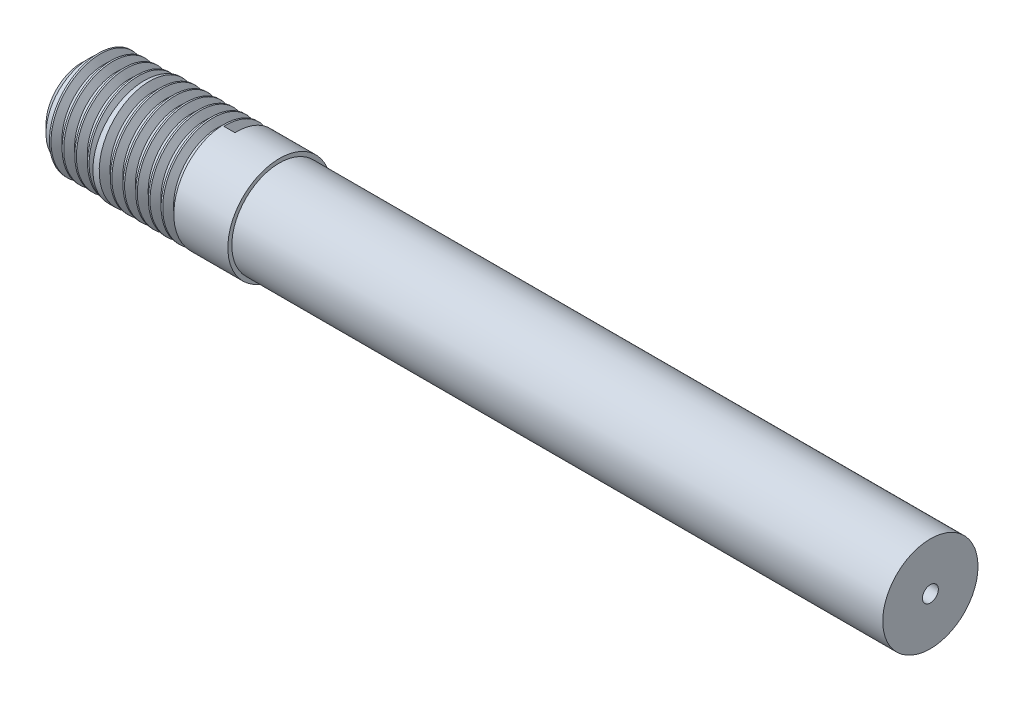
from build123d import *

# Parameters (mm, degrees)
THREAD5_PITCH = 0.8
THREAD6_PITCH = 0.8


# Read off the part's stored shape, not the designer's step: #12-28 Machine Threads Stud1
with BuildPart() as part:
    # Sketch1 → Revolve1 (revolve)
    with BuildSketch(Plane.XY, mode=Mode.PRIVATE) as revolve1_sk:
        Polygon((10, 0.5), (11, 0.5), (11, 3), (-30, 3), (-30, 3.25), (-38.5, 3.25), (-38.5, 3), (-42.5, 3), (-42.5, 2.25), (10, 2.25), align=None)
    revolve(revolve1_sk.sketch.rotate(Axis((13.5, 0, 0), (-1, 0, 0)), 90), axis=Axis((13.5, 0, 0), (-1, 0, 0)))

    # #12-28 Machine Threads Stud1 outline → #12-28 Machine Threads Stud1 (revolve, cut)
    with BuildSketch(Plane.YX):
        Polygon((3, -38.5), (2.7432, -38.5), (2.7432, -41.95898), (2.25, -42.45218), (2.25, -42.5), (3, -42.5), align=None)
    revolve(axis=Axis((0, 0, 0), (1, 0, 0)), mode=Mode.SUBTRACT)

    # Thread5: the profile of Thread Profile6 profile screwed along a right-hand helix of 10 turns, 8 arcs to a turn; built about Z, then put on its axis
    thread5_z = Axis((0, 0, 0), (0, 0, 1))
    thread5_corners = [(2.7429, 0, -0.000173205), (3.1762127, 0, 0.249999999), (3.1762127, 0, 0.349999999), (2.7429, 0, 0.600173203)]
    with BuildLine(mode=Mode.PRIVATE) as thread5_profile:
        Line(thread5_corners[0], thread5_corners[1])
        Line(thread5_corners[1], thread5_corners[2])
        Line(thread5_corners[2], thread5_corners[3])
        Line(thread5_corners[3], thread5_corners[0])
    thread5_cap = Face(thread5_profile.wire())
    thread5_turn_angles = [0, 22.5, 45, 67.5, 90, 112.5, 135, 157.5, 180, 202.5, 225, 247.5, 270, 292.5, 315, 337.5, 360]
    thread5_turn_weights = [1, 0.9238795325112867, 1, 0.9238795325112867, 1, 0.9238795325112867, 1, 0.9238795325112867, 1, 0.9238795325112867, 1, 0.9238795325112867, 1, 0.9238795325112867, 1, 0.9238795325112867, 1]
    thread5_turn_rails = [Edge.make_bspline([Vector(p[0], p[1], 0).rotate(thread5_z, thread5_turn_angles[k]) / thread5_turn_weights[k] + Vector(0, 0, p[2] + THREAD5_PITCH * thread5_turn_angles[k] / 360) for k in range(17)], [0, 0, 0, 1, 1, 2, 2, 3, 3, 4, 4, 5, 5, 6, 6, 7, 7, 8, 8, 8], 2, thread5_turn_weights) for p in thread5_corners]
    thread5_turn_sides = [Face.make_surface_from_curves(thread5_turn_rails[p[0]], thread5_turn_rails[p[1]]) for p in [(0, 1), (1, 2), (2, 3), (3, 0)]]
    thread5 = Plane(origin=(-41.95898, 0, 0), x_dir=(0, 0, -1), z_dir=(1, 0, 0)) * Solid(Shell([*[p.moved(Location((0, 0, THREAD5_PITCH * i))) for i in range(10) for p in thread5_turn_sides], thread5_cap, thread5_cap.rotate(thread5_z, 3600).moved(Location((0, 0, THREAD5_PITCH * 3600 / 360)))]))
    add(thread5)

    # Thread6: the profile of Thread Profile7 profile screwed along a right-hand helix of 6.25 turns, 8 arcs to a turn; built about Z, then put on its axis
    thread6_z = Axis((0, 0, 0), (0, 0, 1))
    thread6_corners = [(3.2503, 0, -0.000173205), (3.2503, 0, 0.700173203), (2.8169873, 0, 0.449999999), (2.8169873, 0, 0.249999999)]
    with BuildLine(mode=Mode.PRIVATE) as thread6_profile:
        Line(thread6_corners[0], thread6_corners[1])
        Line(thread6_corners[1], thread6_corners[2])
        Line(thread6_corners[2], thread6_corners[3])
        Line(thread6_corners[3], thread6_corners[0])
    thread6_cap = Face(thread6_profile.wire())
    thread6_turn_angles = [0, 22.5, 45, 67.5, 90, 112.5, 135, 157.5, 180, 202.5, 225, 247.5, 270, 292.5, 315, 337.5, 360]
    thread6_turn_weights = [1, 0.9238795325112867, 1, 0.9238795325112867, 1, 0.9238795325112867, 1, 0.9238795325112867, 1, 0.9238795325112867, 1, 0.9238795325112867, 1, 0.9238795325112867, 1, 0.9238795325112867, 1]
    thread6_turn_rails = [Edge.make_bspline([Vector(p[0], p[1], 0).rotate(thread6_z, thread6_turn_angles[k]) / thread6_turn_weights[k] + Vector(0, 0, p[2] + THREAD6_PITCH * thread6_turn_angles[k] / 360) for k in range(17)], [0, 0, 0, 1, 1, 2, 2, 3, 3, 4, 4, 5, 5, 6, 6, 7, 7, 8, 8, 8], 2, thread6_turn_weights) for p in thread6_corners]
    thread6_turn_sides = [Face.make_surface_from_curves(thread6_turn_rails[p[0]], thread6_turn_rails[p[1]]) for p in [(0, 1), (1, 2), (2, 3), (3, 0)]]
    thread6_last_angles = [2160, 2182.5, 2205, 2227.5, 2250]
    thread6_last_weights = [1, 0.9238795325112867, 1, 0.9238795325112867, 1]
    thread6_last_rails = [Edge.make_bspline([Vector(p[0], p[1], 0).rotate(thread6_z, thread6_last_angles[k]) / thread6_last_weights[k] + Vector(0, 0, p[2] + THREAD6_PITCH * thread6_last_angles[k] / 360) for k in range(5)], [0, 0, 0, 1, 1, 2, 2, 2], 2, thread6_last_weights) for p in thread6_corners]
    thread6_last_sides = [Face.make_surface_from_curves(thread6_last_rails[p[0]], thread6_last_rails[p[1]]) for p in [(0, 1), (1, 2), (2, 3), (3, 0)]]
    thread6 = Plane(origin=(-38.5, 0, 0), x_dir=(0, 0, -1), z_dir=(1, 0, 0)) * Solid(Shell([*[p.moved(Location((0, 0, THREAD6_PITCH * i))) for i in range(6) for p in thread6_turn_sides], *thread6_last_sides, thread6_cap, thread6_cap.rotate(thread6_z, 2250).moved(Location((0, 0, THREAD6_PITCH * 2250 / 360)))]))
    add(thread6, mode=Mode.SUBTRACT)


solid = part.part
